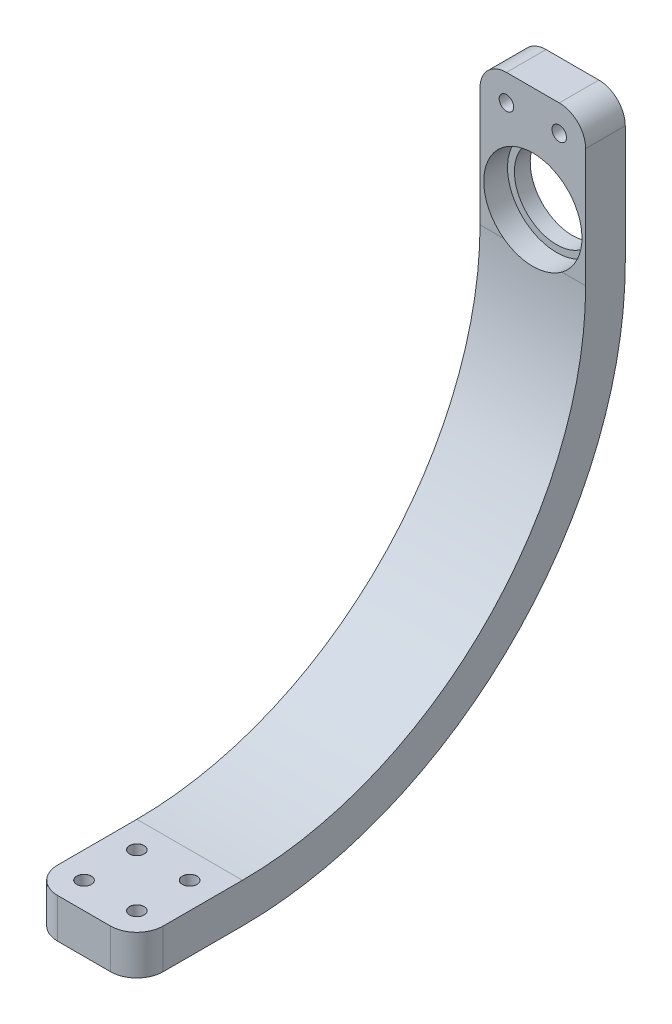
from build123d import *

# Parameters (mm, degrees)
BOSS_EXTRUDE2_DEPTH            = 40
M5_CLEARANCE_HOLE2_D           = 5.5
M5_CLEARANCE_HOLE2_CSINK_D     = 5.55
M5_CLEARANCE_HOLE2_CSINK_ANGLE = 90
CUT_EXTRUDE1_REACH             = 277.363
SKETCH10_R                     = 16
CUT_EXTRUDE2_DEPTH             = 10
CUT_EXTRUDE2_DEPTH_BACK        = 9
SKETCH12_R                     = 18.6
FILLET1_R                      = 10
M5_CLEARANCE_HOLE3_D           = 5.5
M5_CLEARANCE_HOLE3_CSINK_D     = 5.55
M5_CLEARANCE_HOLE3_CSINK_ANGLE = 90


with BuildPart() as part:
    # Sketch6 → Boss-Extrude2 (new body)
    with BuildSketch(Plane(origin=(0, 0, 0), x_dir=(0, 0, -1), z_dir=(1, 0, 0))):
        with BuildLine():
            Line((0, 0), (40, 0))
            ThreePointArc((40, 0), (142.530483272, 42.469516728), (185, 145))
            Line((185, 145), (185, 200))
            Line((185, 200), (170, 200))
            Line((170, 200), (170, 145))
            ThreePointArc((170, 145), (131.923881554, 53.076118446), (40, 15))
            Line((40, 15), (0, 15))
            Line((0, 15), (0, 0))
        make_face()
    extrude(amount=BOSS_EXTRUDE2_DEPTH)

    # M5 Clearance Hole2 (through all)
    with Locations(Plane(origin=(0, 15, 0), x_dir=(1, 0, 0), z_dir=(0, 1, 0))):
        with Locations((10, 30), (30, 30), (10, 10), (30, 10)):
            CounterSinkHole(M5_CLEARANCE_HOLE2_D / 2, M5_CLEARANCE_HOLE2_CSINK_D / 2, counter_sink_angle=M5_CLEARANCE_HOLE2_CSINK_ANGLE)

    # Sketch10 → Cut-Extrude1 (cut, up to next)
    with BuildSketch(Plane(origin=(0, 0, -185), x_dir=(-1, 0, 0), z_dir=(0, 0, -1)), mode=Mode.PRIVATE) as cut_extrude1_sk1:
        with Locations((-20, 160)):
            Circle(SKETCH10_R)
    cut_extrude1_tool1 = extrude(cut_extrude1_sk1.sketch, amount=-CUT_EXTRUDE1_REACH, mode=Mode.PRIVATE) & part.part
    add(cut_extrude1_tool1.solids().sort_by_distance((20, 160, -185))[0], mode=Mode.SUBTRACT)

    # Sketch12 → Cut-Extrude2 (cut, two sides: drawn at the far end of the back side and taken through both)
    with BuildSketch(Plane.XY.offset(-170).offset(-CUT_EXTRUDE2_DEPTH_BACK)):
        with Locations((20, 160)):
            Circle(SKETCH12_R)
    extrude(amount=CUT_EXTRUDE2_DEPTH + CUT_EXTRUDE2_DEPTH_BACK, mode=Mode.SUBTRACT)

    # Fillet1
    fillet1_edges = [part.edges().sort_by_distance(p)[0] for p in [
        (40, 7.5, 0),
        (0, 7.5, 0),
        (40, 200, -177.5),
        (0, 200, -177.5),
    ]]
    fillet(fillet1_edges, radius=FILLET1_R)

    # M5 Clearance Hole3 (through all)
    with Locations(Plane(origin=(0, 0, -185), x_dir=(-1, 0, 0), z_dir=(0, 0, -1))):
        with Locations((-30, 190), (-10, 190)):
            CounterSinkHole(M5_CLEARANCE_HOLE3_D / 2, M5_CLEARANCE_HOLE3_CSINK_D / 2, counter_sink_angle=M5_CLEARANCE_HOLE3_CSINK_ANGLE)


solid = part.part
